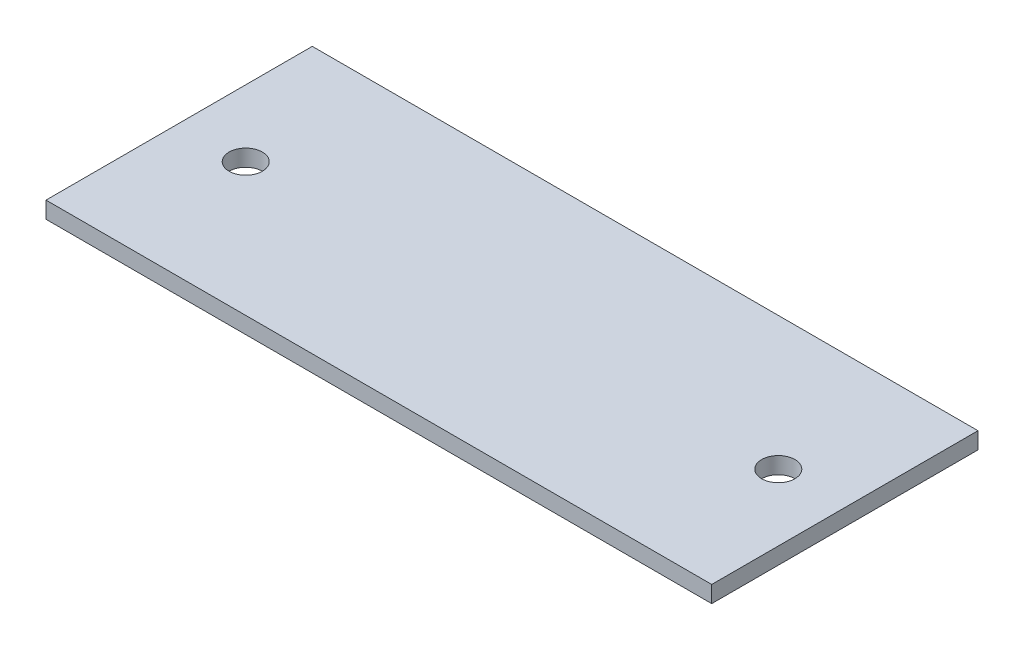
from build123d import *

# Parameters (mm, degrees)
SKETCH1_W           = 127
SKETCH1_H           = 50.8
BOSS_EXTRUDE1_DEPTH = 3.175
SKETCH2_R           = 3.175
CUT_EXTRUDE1_DEPTH  = 24.638


with BuildPart() as part:
    # Sketch1 → Boss-Extrude1 (new body)
    with BuildSketch(Plane(origin=(0, 0, 0), x_dir=(1, 0, 0), z_dir=(0, 1, 0))):
        with Locations((63.5, 25.4)):
            Rectangle(SKETCH1_W, SKETCH1_H)
    extrude(amount=BOSS_EXTRUDE1_DEPTH)

    # Sketch2 → Cut-Extrude1 (cut)
    with BuildSketch(Plane(origin=(0, 0, 0), x_dir=(-1, 0, 0), z_dir=(0, -1, 0))):
        with Locations((-114.3, 25.4)):
            Circle(SKETCH2_R)
        with Locations((-12.7, 25.4)):
            Circle(SKETCH2_R)
    extrude(amount=-CUT_EXTRUDE1_DEPTH, mode=Mode.SUBTRACT)


solid = part.part
